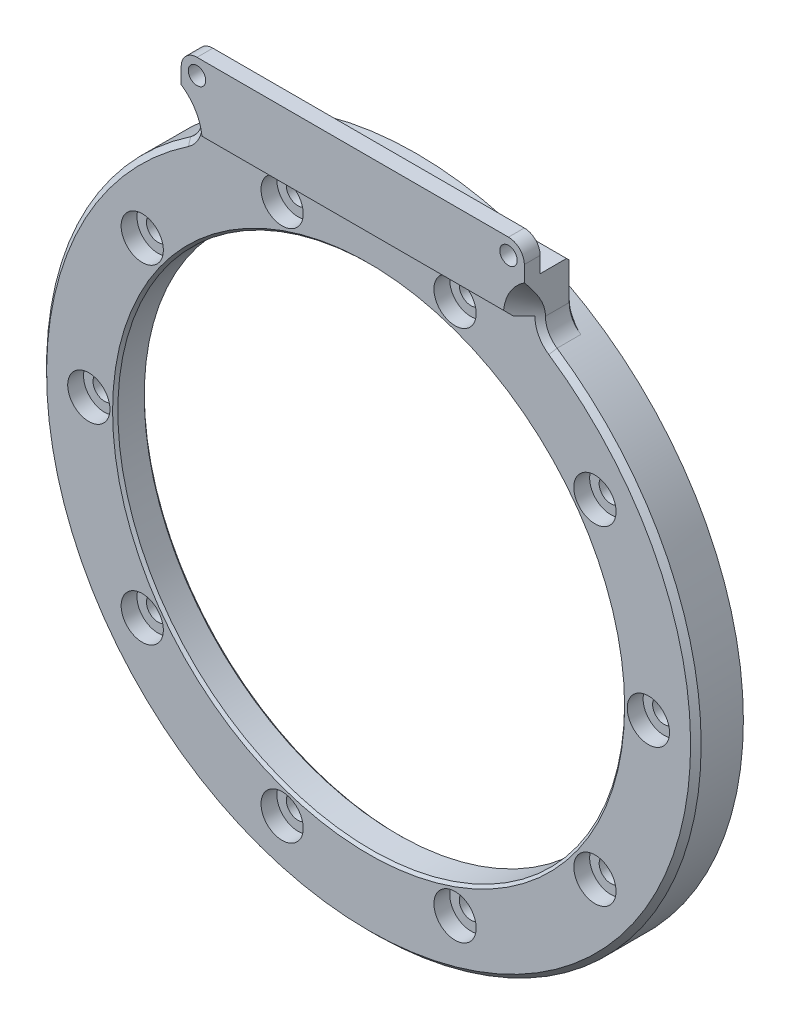
from build123d import *

# Parameters (mm, degrees)
SKETCH_1_R          = 62
SKETCH_1_R_2        = 60
EXTRUDE_1_DEPTH     = 3
EXTRUDE_START       = 6
SKETCH_2_R          = 48
EXTRUDE_2_DEPTH     = 6
FILLET_1_R          = 5
CHAMFER_1_SIZE      = 0.5
CHAMFER_2_SIZE      = 0.5
SKETCH_6_R          = 2.2
CUT_EXTRUDE_1_DEPTH = 6
SKETCH_7_W          = 65
SKETCH_7_H          = 13.477482046
EXTRUDE_3_DEPTH     = 3
SKETCH_11_R         = 1.65
CUT_EXTRUDE_2_DEPTH = 3
CHAMFER_3_SIZE      = 1
CHAMFER_4_SIZE      = 1
FILLET_2_R          = 3
CHAMFER_5_3_ANGLE   = 291.929687
SKETCH_12_R         = 4
CUT_EXTRUDE_3_DEPTH = 3


with BuildPart() as part:
    # 草图1 → 凸台-拉伸1 (new body)
    with BuildSketch(Plane.XY):
        Circle(SKETCH_1_R)
        Circle(SKETCH_1_R_2, mode=Mode.SUBTRACT)
    extrude(amount=-EXTRUDE_1_DEPTH)

    # 草图2 → 凸台-拉伸2 (add)
    with BuildSketch(Plane.XY.offset(EXTRUDE_START)):
        with BuildLine():
            Line((-32.5, 63), (32.5, 63))
            Line((32.5, 63), (32.5, 52.79914772))
            ThreePointArc((32.5, 52.79914772), (0, -62), (-32.5, 52.79914772))
            Line((-32.5, 52.79914772), (-32.5, 63))
        make_face()
        Circle(SKETCH_2_R, mode=Mode.SUBTRACT)
    extrude(amount=-EXTRUDE_2_DEPTH)

    # 圆角1
    # the kernel refuses this fillet: 5 mm, written as the material it adds along each edge
    with BuildSketch(Plane(origin=(32.5, 52.79914772, 6), x_dir=(0.8403342947446245, -0.5420685132675156, 0), z_dir=(0, 0, -1))) as fillet_1_piece_1:
        with BuildLine():
            CenterArc((2.72541822, -4.998883971), FILLET_1_R, 91.210593649, 55.964843523)
            Line((-1.476253254, -2.288541405), (0, 0))
            ThreePointArc((0, 0), (1.309890927, -0.013838756), (2.619781855, 0))
        make_face()
    extrude(amount=6)
    with BuildSketch(Plane(origin=(-32.5, 52.79914772, 6), x_dir=(-0.840334294744627, -0.5420685132675117, 0), z_dir=(0, 0, -1))) as fillet_1_piece_2:
        with BuildLine():
            CenterArc((2.72541822, 4.998883971), FILLET_1_R, 212.824562828, 55.964843523)
            Line((-1.476253254, 2.288541405), (0, 0))
            ThreePointArc((0, 0), (1.309890927, 0.013838756), (2.619781855, 0))
        make_face()
    extrude(amount=6)

    # 倒角1
    chamfer_1_edges = [part.edges().sort_by_distance(p)[0] for p in [
        (-48, 0, 0),
        (-48, 0, 6),
        (-60, 0, -3),
    ]]
    chamfer(chamfer_1_edges, length=CHAMFER_1_SIZE)

    # 倒角2
    # the kernel refuses this chamfer: 0.5 mm, written as the material it takes off along each edge
    with BuildSketch(Plane(origin=(-32.5, 55.522517954, 0), x_dir=(0, 0, 1), z_dir=(0, 1, 0)), Plane(origin=(32.5, 64.285841494, 0), x_dir=(0, 0, 1), z_dir=(0, -1, 0))) as chamfer_2_piece_1:
        Polygon((CHAMFER_2_SIZE, 0), (0, CHAMFER_2_SIZE), (0, 0), align=None)
    extrude(amount=8.76332354, mode=Mode.SUBTRACT)
    with BuildSketch(Plane(origin=(37.5, 55.522517954, 0), x_dir=(-0.15613015555825177, -0.9877364904291813, 0), z_dir=(0.9877364904291813, -0.15613015555825177, 0))) as chamfer_2_piece_2_section:
        Polygon((5, -CHAMFER_2_SIZE), (5 + CHAMFER_2_SIZE, 0), (5, 0), align=None)
    chamfer_2_piece_2 = revolve(axis=Axis((37.5, 55.522517954, 0), (0, 0, -1)), revolution_arc=81.017652556, mode=Mode.PRIVATE)
    chamfer_2_piece_2 = chamfer_2_piece_2 - Plane(origin=(0, 0, 0), x_dir=(1, 0, 0), z_dir=(0, 0, 1)) * Cylinder(62, 22, mode=Mode.PRIVATE)
    add(chamfer_2_piece_2, mode=Mode.SUBTRACT)
    with BuildSketch(Plane(origin=(-37.5, 55.522517954, 0), x_dir=(1, 0, 0), z_dir=(0, 1, 0))) as chamfer_2_piece_3_section:
        Polygon((5, -CHAMFER_2_SIZE), (5 + CHAMFER_2_SIZE, 0), (5, 0), align=None)
    chamfer_2_piece_3 = revolve(axis=Axis((-37.5, 55.522517954, 0), (0, 0, -1)), revolution_arc=81.017652556, mode=Mode.PRIVATE)
    chamfer_2_piece_3 = chamfer_2_piece_3 - Plane(origin=(0, 0, 0), x_dir=(1, 0, 0), z_dir=(0, 0, 1)) * Cylinder(62, 22, mode=Mode.PRIVATE)
    add(chamfer_2_piece_3, mode=Mode.SUBTRACT)

    # 草图6 → 切除-拉伸1 (cut)
    with BuildSketch(Plane(origin=(0, 0, 0), x_dir=(-1, 0, 0), z_dir=(0, 0, -1))):
        with Locations((-42.877900702, 31.152618372)):
            Circle(SKETCH_6_R)
        with Locations((-53, 0)):
            Circle(SKETCH_6_R)
        with Locations((-42.877900702, -31.152618371)):
            Circle(SKETCH_6_R)
        with Locations((-16.377900702, -50.405995364)):
            Circle(SKETCH_6_R)
        with Locations((16.377900702, -50.405995364)):
            Circle(SKETCH_6_R)
        with Locations((42.877900702, -31.152618371)):
            Circle(SKETCH_6_R)
        with Locations((53, 0)):
            Circle(SKETCH_6_R)
        with Locations((42.877900702, 31.152618372)):
            Circle(SKETCH_6_R)
        with Locations((16.377900702, 50.405995364)):
            Circle(SKETCH_6_R)
        with Locations((-16.377900702, 50.405995364)):
            Circle(SKETCH_6_R)
    extrude(amount=-CUT_EXTRUDE_1_DEPTH, mode=Mode.SUBTRACT)

    # 草图7 → 凸台-拉伸3 (add)
    with BuildSketch(Plane.XY.offset(6)):
        with Locations((0, 62.261258977)):
            Rectangle(SKETCH_7_W, SKETCH_7_H)
    extrude(amount=EXTRUDE_3_DEPTH)

    # 草图11 → 切除-拉伸2 (cut)
    with BuildSketch(Plane.XY.offset(9)):
        with Locations((-29.5, 66)):
            Circle(SKETCH_11_R)
        with Locations((29.5, 66)):
            Circle(SKETCH_11_R)
    extrude(amount=-CUT_EXTRUDE_2_DEPTH, mode=Mode.SUBTRACT)

    # 倒角3
    chamfer_3_edges = [part.edges().sort_by_distance(p)[0] for p in [
        (0, 63, 0),
    ]]
    chamfer(chamfer_3_edges, length=CHAMFER_3_SIZE - 0.0001)  # a hair under: the kernel refuses the full size

    # 倒角4
    chamfer_4_edges = [part.edges().sort_by_distance(p)[0] for p in [
        (0, 55.522517954, 9),
    ]]
    chamfer(chamfer_4_edges, length=CHAMFER_4_SIZE)

    # 圆角2
    fillet_2_edges = [part.edges().sort_by_distance(p)[0] for p in [
        (-32.5, 69, 7.5),
        (32.5, 69, 7.5),
    ]]
    fillet(fillet_2_edges, radius=FILLET_2_R)

    # 倒角5: read off the stored shape, not the designer's step
    # 倒角5 outline → 倒角5 (revolve, cut)
    with BuildSketch(Plane(origin=(37.5, 55.522517954, 0), x_dir=(1, 0, 0), z_dir=(0, -1, 0))):
        Polygon((4.999998721, 9), (4.999998721, 4.999998721), (9, 9), align=None)
    revolve(axis=Axis((37.5, 55.522517954, 0), (0, 0, 1)), mode=Mode.SUBTRACT)

    # Chamfer 5 2 outline → Chamfer 5 2 (revolve, cut)
    with BuildSketch(Plane(origin=(-37.5, 55.522517954, 0), x_dir=(1, 0, 0), z_dir=(0, -1, 0))):
        Polygon((4.99999762, 9), (4.99999762, 4.99999762), (9, 9), align=None)
    revolve(axis=Axis((-37.5, 55.522517954, 0), (0, 0, 1)), mode=Mode.SUBTRACT)

    # Chamfer 5 3 outline → Chamfer 5 3 (revolve, cut)
    with BuildSketch(Plane(origin=(0, 0, 0), x_dir=(-0.5597014925373135, 0.8286942978273132, 0), z_dir=(0.8286942978273132, 0.5597014925373135, 0))):
        Polygon((62, 6), (61, 6), (62, 5), align=None)
    revolve(axis=Axis((0, 0, 0), (0, 0, 1)), revolution_arc=CHAMFER_5_3_ANGLE, mode=Mode.SUBTRACT)

    # 草图12 → 切除-拉伸3 (cut)
    with BuildSketch(Plane.XY.offset(6)):
        with Locations((-16.377900702, 50.405995364)):
            Circle(SKETCH_12_R)
        with Locations((16.377900702, 50.405995364)):
            Circle(SKETCH_12_R)
        with Locations((42.877900702, 31.152618372)):
            Circle(SKETCH_12_R)
        with Locations((53, 0)):
            Circle(SKETCH_12_R)
        with Locations((42.877900702, -31.152618371)):
            Circle(SKETCH_12_R)
        with Locations((16.377900702, -50.405995364)):
            Circle(SKETCH_12_R)
        with Locations((-16.377900702, -50.405995364)):
            Circle(SKETCH_12_R)
        with Locations((-42.877900702, -31.152618371)):
            Circle(SKETCH_12_R)
        with Locations((-53, 0)):
            Circle(SKETCH_12_R)
        with Locations((-42.877900702, 31.152618372)):
            Circle(SKETCH_12_R)
    extrude(amount=-CUT_EXTRUDE_3_DEPTH, mode=Mode.SUBTRACT)


solid = part.part
